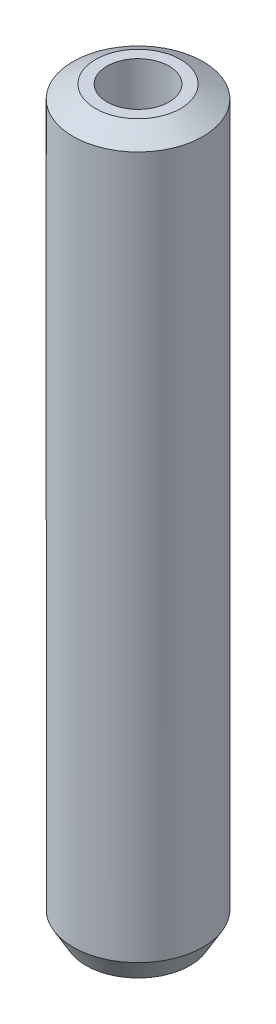
from build123d import *
from OCP.BRepFilletAPI import BRepFilletAPI_MakeChamfer

# Parameters (mm, degrees)
SKETCH1_R           = 10
BOSS_EXTRUDE1_DEPTH = 113.502418023
SKETCH2_R           = 4.780613643
CUT_EXTRUDE1_DEPTH  = 115.380063373
CHAMFER1_SIZE       = 1.994315573
CHAMFER1_SIZE2      = 3.454255898


with BuildPart() as part:
    # Sketch1 → Boss-Extrude1 (new body)
    with BuildSketch(Plane(origin=(0, 0, 0), x_dir=(1, 0, 0), z_dir=(0, 1, 0))):
        Circle(SKETCH1_R)
    extrude(amount=BOSS_EXTRUDE1_DEPTH)

    # Sketch2 → Cut-Extrude1 (cut, through all)
    with BuildSketch(Plane(origin=(0, 0, 0), x_dir=(1, 0, 0), z_dir=(0, 1, 0))):
        Circle(SKETCH2_R)
    extrude(amount=CUT_EXTRUDE1_DEPTH, mode=Mode.SUBTRACT)

    # Chamfer1: one chamfer whose edges measure the first distance from different faces: ONE call of the kernel's chamfer builder (chamfer() names one face for all edges)
    chamfer1_edges_1 = [part.edges().sort_by_distance(p)[0] for p in [
        (-10, 113.502418023, 0),
    ]]
    chamfer1_side_1 = [part.faces().sort_by_distance(p)[0] for p in [
        (-10, 56.751209012, 0),
    ]]
    chamfer1_edges_2 = [part.edges().sort_by_distance(p)[0] for p in [
        (-10, 0, 0),
    ]]
    chamfer1_side_2 = [part.faces().sort_by_distance(p)[0] for p in [
        (-9.717157288, 0, 0),
    ]]
    chamfer1 = BRepFilletAPI_MakeChamfer(part.part.solid().wrapped)
    for e in chamfer1_edges_1:
        chamfer1.Add(CHAMFER1_SIZE, CHAMFER1_SIZE2, e.wrapped, chamfer1_side_1[0].wrapped)  # the first distance lies on this face
    for e in chamfer1_edges_2:
        chamfer1.Add(CHAMFER1_SIZE, CHAMFER1_SIZE2, e.wrapped, chamfer1_side_2[0].wrapped)  # the first distance lies on this face
    add(Compound.cast(chamfer1.Shape()), mode=Mode.REPLACE)


solid = part.part
